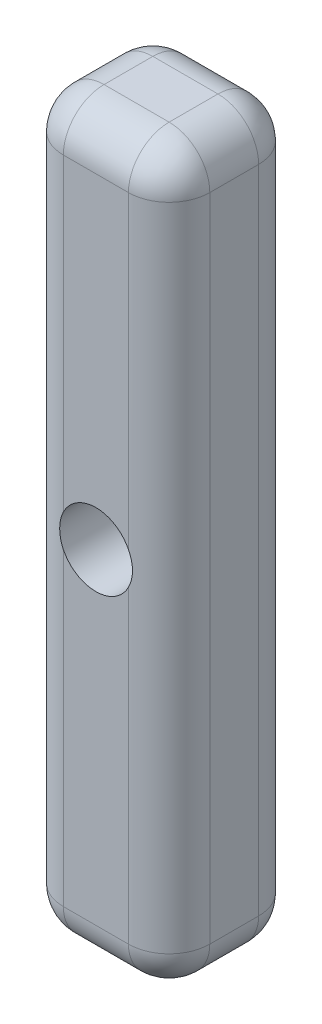
from build123d import *

# Parameters (mm, degrees)
SKETCH7_W           = 90
SKETCH7_H           = 18
BOSS_EXTRUDE1_DEPTH = 16
SKETCH8_R           = 4.475
CUT_EXTRUDE2_DEPTH  = 12.7
FILLET1_R           = 5


with BuildPart() as part:
    # Sketch7 → Boss-Extrude1 (new body)
    with BuildSketch(Plane(origin=(0, 0, 0), x_dir=(0, 1, 0), z_dir=(0, 0, 1))):
        Rectangle(SKETCH7_W, SKETCH7_H)
    extrude(amount=BOSS_EXTRUDE1_DEPTH)

    # Sketch8 → Cut-Extrude2 (cut)
    with BuildSketch(Plane(origin=(0, 0, 16), x_dir=(0, -1, 0), z_dir=(0, 0, 1))):
        with Locations(Location((0, 0, 0), (0, 0, 90))):
            Circle(SKETCH8_R)
    extrude(amount=-CUT_EXTRUDE2_DEPTH, mode=Mode.SUBTRACT)

    # Fillet1
    # the kernel refuses this fillet: 5 mm, written as the material it takes off along each edge
    with BuildSketch(Plane(origin=(-4, -40, 11), x_dir=(0, 0, 1), z_dir=(0, -1, 0))) as fillet1_piece_1_section:
        Polygon((0, 0), (FILLET1_R, 0), (FILLET1_R, FILLET1_R), (0, FILLET1_R), align=None)
    fillet1_piece_1 = extrude(amount=FILLET1_R, mode=Mode.PRIVATE)
    fillet1_piece_1 = fillet1_piece_1 - Plane(origin=(-4, -40, 11), x_dir=(0.7071067811865475, 0, -0.7071067811865475), z_dir=(0, -1, 0)) * Sphere(FILLET1_R, mode=Mode.PRIVATE)
    add(fillet1_piece_1, mode=Mode.SUBTRACT)
    with BuildSketch(Plane(origin=(4, -40, 11), x_dir=(0, -1, 0), z_dir=(1, 0, 0))) as fillet1_piece_2_section:
        Polygon((0, 0), (FILLET1_R, 0), (FILLET1_R, -FILLET1_R), (0, -FILLET1_R), align=None)
    fillet1_piece_2 = extrude(amount=FILLET1_R, mode=Mode.PRIVATE)
    fillet1_piece_2 = fillet1_piece_2 - Plane(origin=(4, -40, 11), x_dir=(0, 0.7071067811865475, -0.7071067811865475), z_dir=(1, 0, 0)) * Sphere(FILLET1_R, mode=Mode.PRIVATE)
    add(fillet1_piece_2, mode=Mode.SUBTRACT)
    with BuildSketch(Plane(origin=(4, 40, 11), x_dir=(0, 1, 0), z_dir=(1, 0, 0))) as fillet1_piece_3_section:
        Polygon((0, 0), (FILLET1_R, 0), (FILLET1_R, FILLET1_R), (0, FILLET1_R), align=None)
    fillet1_piece_3 = extrude(amount=FILLET1_R, mode=Mode.PRIVATE)
    fillet1_piece_3 = fillet1_piece_3 - Plane(origin=(4, 40, 11), x_dir=(0, -0.7071067811865475, -0.7071067811865475), z_dir=(1, 0, 0)) * Sphere(FILLET1_R, mode=Mode.PRIVATE)
    add(fillet1_piece_3, mode=Mode.SUBTRACT)
    with BuildSketch(Plane(origin=(-4, 40, 11), x_dir=(0, 0, 1), z_dir=(0, 1, 0))) as fillet1_piece_4_section:
        Polygon((0, 0), (FILLET1_R, 0), (FILLET1_R, -FILLET1_R), (0, -FILLET1_R), align=None)
    fillet1_piece_4 = extrude(amount=FILLET1_R, mode=Mode.PRIVATE)
    fillet1_piece_4 = fillet1_piece_4 - Plane(origin=(-4, 40, 11), x_dir=(0.7071067811865475, 0, -0.7071067811865475), z_dir=(0, 1, 0)) * Sphere(FILLET1_R, mode=Mode.PRIVATE)
    add(fillet1_piece_4, mode=Mode.SUBTRACT)
    with BuildSketch(Plane(origin=(4, -40, 5), x_dir=(0, -1, 0), z_dir=(1, 0, 0))) as fillet1_piece_5_section:
        Polygon((0, 0), (FILLET1_R, 0), (FILLET1_R, FILLET1_R), (0, FILLET1_R), align=None)
    fillet1_piece_5 = extrude(amount=FILLET1_R, mode=Mode.PRIVATE)
    fillet1_piece_5 = fillet1_piece_5 - Plane(origin=(4, -40, 5), x_dir=(0, 0.7071067811865475, 0.7071067811865475), z_dir=(1, 0, 0)) * Sphere(FILLET1_R, mode=Mode.PRIVATE)
    add(fillet1_piece_5, mode=Mode.SUBTRACT)
    with BuildSketch(Plane(origin=(4, 40, 5), x_dir=(0, 1, 0), z_dir=(1, 0, 0))) as fillet1_piece_6_section:
        Polygon((0, 0), (FILLET1_R, 0), (FILLET1_R, -FILLET1_R), (0, -FILLET1_R), align=None)
    fillet1_piece_6 = extrude(amount=FILLET1_R, mode=Mode.PRIVATE)
    fillet1_piece_6 = fillet1_piece_6 - Plane(origin=(4, 40, 5), x_dir=(0, -0.7071067811865475, 0.7071067811865475), z_dir=(1, 0, 0)) * Sphere(FILLET1_R, mode=Mode.PRIVATE)
    add(fillet1_piece_6, mode=Mode.SUBTRACT)
    with BuildSketch(Plane(origin=(-4, -40, 5), x_dir=(0, 0, -1), z_dir=(0, -1, 0))) as fillet1_piece_7_section:
        Polygon((0, 0), (FILLET1_R, 0), (FILLET1_R, -FILLET1_R), (0, -FILLET1_R), align=None)
    fillet1_piece_7 = extrude(amount=FILLET1_R, mode=Mode.PRIVATE)
    fillet1_piece_7 = fillet1_piece_7 - Plane(origin=(-4, -40, 5), x_dir=(0.7071067811865475, 0, 0.7071067811865475), z_dir=(0, -1, 0)) * Sphere(FILLET1_R, mode=Mode.PRIVATE)
    add(fillet1_piece_7, mode=Mode.SUBTRACT)
    with BuildSketch(Plane(origin=(-4, 40, 5), x_dir=(0, 0, -1), z_dir=(0, 1, 0))) as fillet1_piece_8_section:
        Polygon((0, 0), (FILLET1_R, 0), (FILLET1_R, FILLET1_R), (0, FILLET1_R), align=None)
    fillet1_piece_8 = extrude(amount=FILLET1_R, mode=Mode.PRIVATE)
    fillet1_piece_8 = fillet1_piece_8 - Plane(origin=(-4, 40, 5), x_dir=(0.7071067811865475, 0, 0.7071067811865475), z_dir=(0, 1, 0)) * Sphere(FILLET1_R, mode=Mode.PRIVATE)
    add(fillet1_piece_8, mode=Mode.SUBTRACT)
    with BuildSketch(Plane(origin=(-4, -45, 16), x_dir=(0, 0, -1), z_dir=(1, 0, 0)), Plane(origin=(4, 45, 16), x_dir=(0, 0, -1), z_dir=(-1, 0, 0))) as fillet1_piece_9:
        with BuildLine():
            CenterArc((FILLET1_R, FILLET1_R), FILLET1_R, 180, 90)
            Line((0, FILLET1_R), (0, 0))
            Line((0, 0), (FILLET1_R, 0))
        make_face()
    extrude(amount=8, mode=Mode.SUBTRACT)
    with BuildSketch(Plane(origin=(9, -40, 16), x_dir=(0, 0, -1), z_dir=(0, 1, 0)), Plane(origin=(-9, 40, 0), x_dir=(1, 0, 0), z_dir=(0, -1, 0))) as fillet1_piece_10:
        with BuildLine():
            CenterArc((FILLET1_R, FILLET1_R), FILLET1_R, 180, 90)
            Line((0, FILLET1_R), (0, 0))
            Line((0, 0), (FILLET1_R, 0))
        make_face()
    extrude(amount=80, mode=Mode.SUBTRACT)
    with BuildSketch(Plane(origin=(9, -40, 0), x_dir=(0, 0, 1), z_dir=(0, 1, 0)), Plane(origin=(-9, 40, 16), x_dir=(1, 0, 0), z_dir=(0, -1, 0))) as fillet1_piece_11:
        with BuildLine():
            CenterArc((FILLET1_R, -FILLET1_R), FILLET1_R, 90, 90)
            Line((0, -FILLET1_R), (0, 0))
            Line((0, 0), (FILLET1_R, 0))
        make_face()
    extrude(amount=80, mode=Mode.SUBTRACT)
    with BuildSketch(Plane(origin=(-4, -45, 0), x_dir=(0, 0, 1), z_dir=(1, 0, 0)), Plane(origin=(4, 45, 0), x_dir=(0, 0, 1), z_dir=(-1, 0, 0))) as fillet1_piece_12:
        with BuildLine():
            CenterArc((FILLET1_R, -FILLET1_R), FILLET1_R, 90, 90)
            Line((0, -FILLET1_R), (0, 0))
            Line((0, 0), (FILLET1_R, 0))
        make_face()
    extrude(amount=8, mode=Mode.SUBTRACT)
    with BuildSketch(Plane(origin=(9, 45, 5), x_dir=(0, -1, 0), z_dir=(0, 0, 1)), Plane(origin=(-9, 45, 5), x_dir=(1, 0, 0), z_dir=(0, 0, 1))) as fillet1_piece_13:
        with BuildLine():
            CenterArc((FILLET1_R, -FILLET1_R), FILLET1_R, 90, 90)
            Line((0, -FILLET1_R), (0, 0))
            Line((0, 0), (FILLET1_R, 0))
        make_face()
    extrude(amount=6, mode=Mode.SUBTRACT)
    with BuildSketch(Plane(origin=(9, -45, 5), x_dir=(0, 1, 0), z_dir=(0, 0, 1)), Plane(origin=(-9, -45, 5), x_dir=(1, 0, 0), z_dir=(0, 0, 1))) as fillet1_piece_14:
        with BuildLine():
            CenterArc((FILLET1_R, FILLET1_R), FILLET1_R, 180, 90)
            Line((0, FILLET1_R), (0, 0))
            Line((0, 0), (FILLET1_R, 0))
        make_face()
    extrude(amount=6, mode=Mode.SUBTRACT)


solid = part.part
